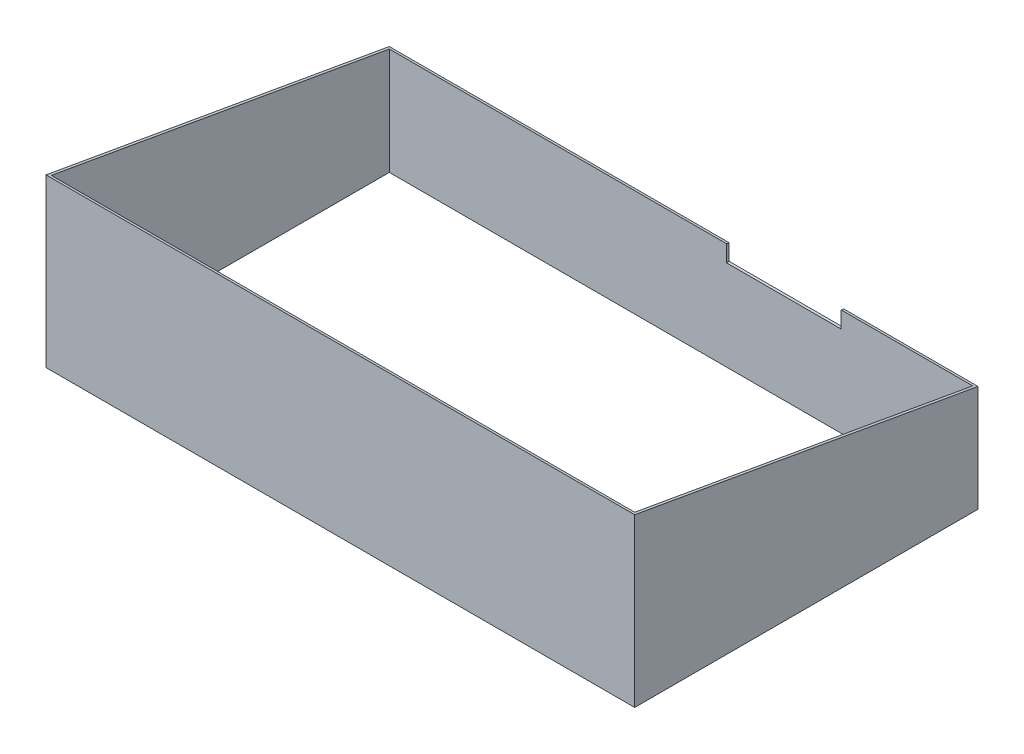
from build123d import *

# Parameters (mm, degrees)
BOSS_EXTRUDE1_DEPTH      = 710.99
BOSS_EXTRUDE1_DEPTH_BACK = 710.99
SHELL1_T                 = -6.35
CUT_EXTRUDE2_REACH       = 1161.896
SKETCH3_W                = 277
SKETCH3_H                = 50
CUT_EXTRUDE3_REACH       = 1696.807
SKETCH4_W                = 93
SKETCH4_H                = 102


with BuildPart() as part:
    # Sketch1 → Boss-Extrude1 (new, two sides: drawn at the far end of the back side and taken through both)
    with BuildSketch(Plane(origin=(0, 0, 0), x_dir=(0, 0, -1), z_dir=(1, 0, 0)).offset(-BOSS_EXTRUDE1_DEPTH_BACK)):
        Polygon((0, 403.229130413), (0, 0), (829.306608812, 0), (829.306608812, 257), align=None)
    extrude(amount=BOSS_EXTRUDE1_DEPTH + BOSS_EXTRUDE1_DEPTH_BACK)

    # Shell1
    shell1_openings = [part.faces().sort_by_distance(p)[0] for p in [
        (0, 0, -414.653304406),
        (0, 330.114565207, -414.653304406),
    ]]
    offset(amount=SHELL1_T, openings=shell1_openings, kind=Kind.INTERSECTION)

    # Sketch3 → Cut-Extrude2 (cut, up to next)
    with BuildSketch(Plane.XY.offset(-822.956608812), mode=Mode.PRIVATE) as cut_extrude2_sk1:
        with Locations((248.49, 243.119676327)):
            Rectangle(SKETCH3_W, SKETCH3_H)
    cut_extrude2_tool1 = extrude(cut_extrude2_sk1.sketch, amount=-CUT_EXTRUDE2_REACH, mode=Mode.PRIVATE) & part.part
    add(cut_extrude2_tool1.solids().sort_by_distance((248.49, 243.119676, -822.956609))[0], mode=Mode.SUBTRACT)

    # Sketch4 → Cut-Extrude3 (cut, up to next)
    with BuildSketch(Plane.ZY.offset(710.99), mode=Mode.PRIVATE) as cut_extrude3_sk1:
        with Locations((-205, 83)):
            Rectangle(SKETCH4_W, SKETCH4_H)
    cut_extrude3_tool1 = extrude(cut_extrude3_sk1.sketch, amount=-CUT_EXTRUDE3_REACH, mode=Mode.PRIVATE) & part.part
    add(cut_extrude3_tool1.solids().sort_by_distance((-710.99, 83, -205))[0], mode=Mode.SUBTRACT)


solid = part.part
